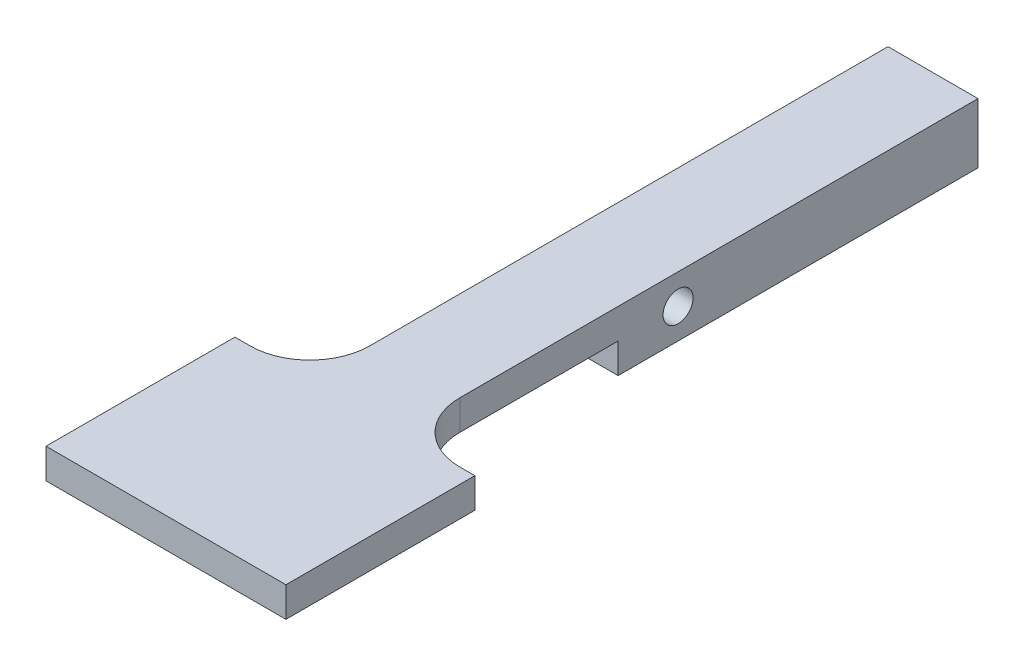
from build123d import *

# Parameters (mm, degrees)
SKETCH1_R           = 1.5875
BOSS_EXTRUDE1_DEPTH = 9.525
SKETCH3_W           = 20
SKETCH3_H           = 3.175
BOSS_EXTRUDE2_DEPTH = 12.7
FILLET1_R           = 6.35


with BuildPart() as part:
    # Sketch1 → Boss-Extrude1 (new body)
    with BuildSketch(Plane(origin=(0, 0, 0), x_dir=(0, 0, -1), z_dir=(1, 0, 0))):
        Polygon((0, -1.5875), (0, 1.5875), (-76.2, 1.5875), (-76.2, -1.5875), (-38.1, -1.5875), (-38.1, -4.7625), (-25.4, -4.7625), (0, -4.7625), align=None)
        with Locations((-31.75, -1.5875)):
            Circle(SKETCH1_R, mode=Mode.SUBTRACT)
    extrude(amount=BOSS_EXTRUDE1_DEPTH)

    # Sketch3 → Boss-Extrude2 (add, symmetric)
    with BuildSketch(Plane(origin=(4.7625, 0, 0), x_dir=(0, 0, -1), z_dir=(1, 0, 0))):
        with Locations((-71.2, 0)):
            Rectangle(SKETCH3_W, SKETCH3_H)
    extrude(amount=BOSS_EXTRUDE2_DEPTH, both=True)

    # Fillet1
    fillet1_edges = [part.edges().sort_by_distance(p)[0] for p in [
        (0, 0, 61.2),
        (9.525, 0, 61.2),
    ]]
    fillet(fillet1_edges, radius=FILLET1_R)


solid = part.part
